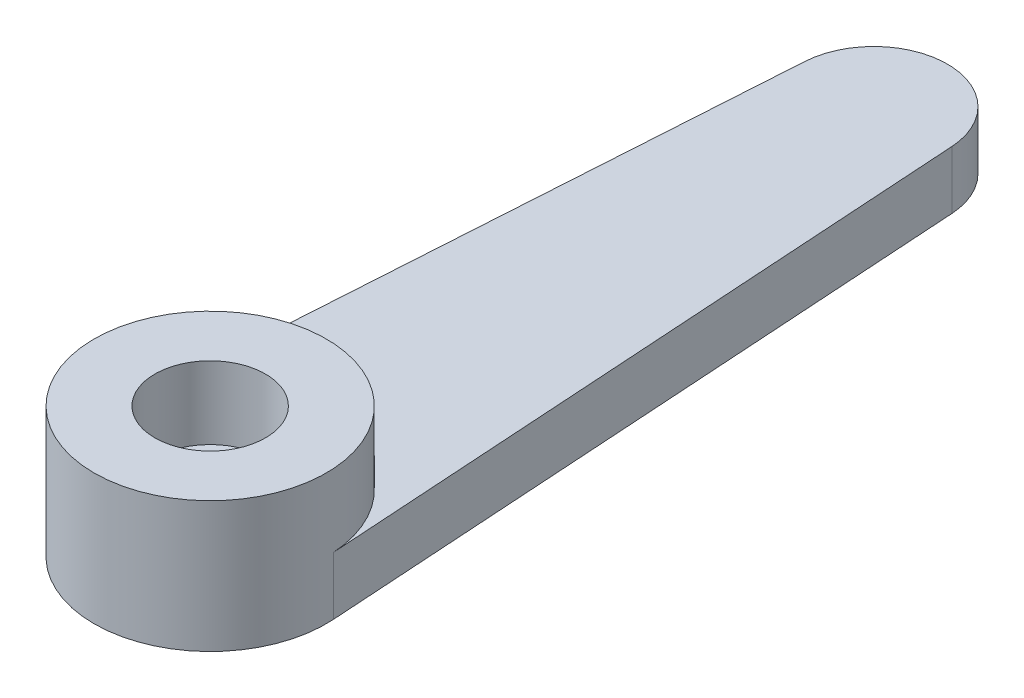
from build123d import *

# Parameters (mm, degrees)
BOSS_EXTRUDE1_DEPTH = 2
SKETCH2_R           = 4
SKETCH2_R_2         = 1.906385326
BOSS_EXTRUDE2_DEPTH = 2.5


with BuildPart() as part:
    # Sketch1 → Boss-Extrude1 (new body)
    with BuildSketch(Plane(origin=(0, 0, 0), x_dir=(1, 0, 0), z_dir=(0, 1, 0))):
        with BuildLine():
            Line((-2.534814382, 23.022222222), (-3.991833672, 0.255468066))
            ThreePointArc((-3.991833672, 0.255468066), (0, -4), (3.991833672, 0.255468066))
            Line((3.991833672, 0.255468066), (2.534814382, 23.022222222))
            ThreePointArc((2.534814382, 23.022222222), (0, 25.4), (-2.534814382, 23.022222222))
        make_face()
    extrude(amount=BOSS_EXTRUDE1_DEPTH)

    # Sketch2 → Boss-Extrude2 (add)
    with BuildSketch(Plane(origin=(0, 2, 0), x_dir=(1, 0, 0), z_dir=(0, 1, 0))):
        Circle(SKETCH2_R)
        Circle(SKETCH2_R_2, mode=Mode.SUBTRACT)
    extrude(amount=BOSS_EXTRUDE2_DEPTH)


solid = part.part
